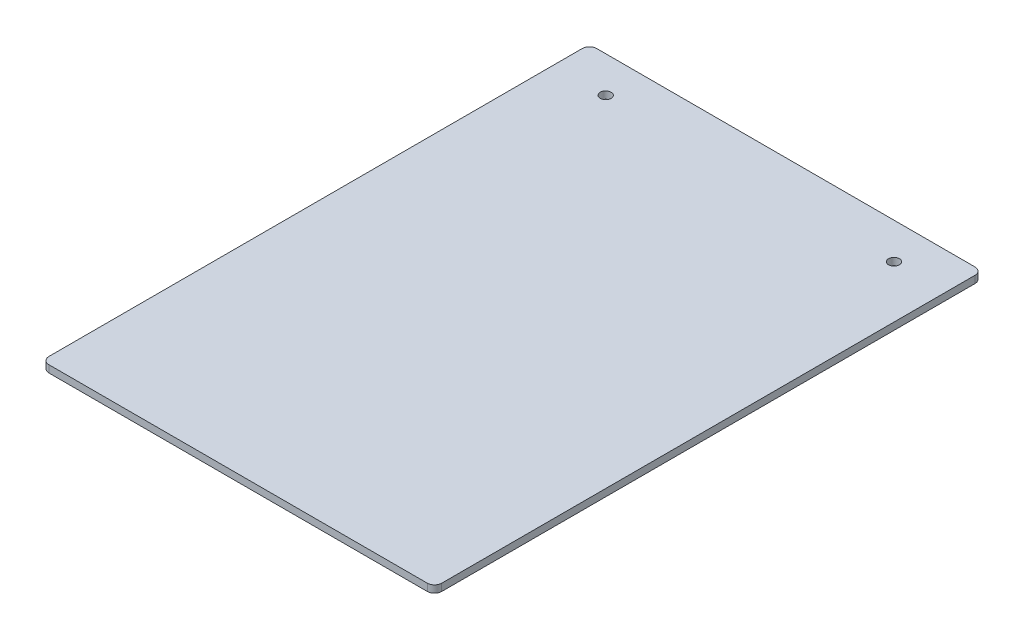
from build123d import *

# Parameters (mm, degrees)
SKETCH1_W                    = 346.075
SKETCH1_H                    = 482.6
BOSS_EXTRUDE1_DEPTH          = 6.35
FILLET1_R                    = 6.35
F_3_8_0_375_DIAMETER_HOLE1_D = 9.525


with BuildPart() as part:
    # Sketch1 → Boss-Extrude1 (new body)
    with BuildSketch(Plane(origin=(0, 0, 0), x_dir=(1, 0, 0), z_dir=(0, 1, 0))):
        Rectangle(SKETCH1_W, SKETCH1_H)
    extrude(amount=BOSS_EXTRUDE1_DEPTH)

    # Fillet1
    fillet1_edges = [part.edges().sort_by_distance(p)[0] for p in [
        (173.0375, 3.175, -241.3),
        (-173.0375, 3.175, -241.3),
        (-173.0375, 3.175, 241.3),
        (173.0375, 3.175, 241.3),
    ]]
    fillet(fillet1_edges, radius=FILLET1_R)

    # 3/8 (0.375) Diameter Hole1 (through all)
    with Locations(Plane(origin=(0, 6.35, 0), x_dir=(1, 0, 0), z_dir=(0, 1, 0))):
        with Locations((-127, 209.55), (127, 209.55)):
            Hole(F_3_8_0_375_DIAMETER_HOLE1_D / 2)


solid = part.part
